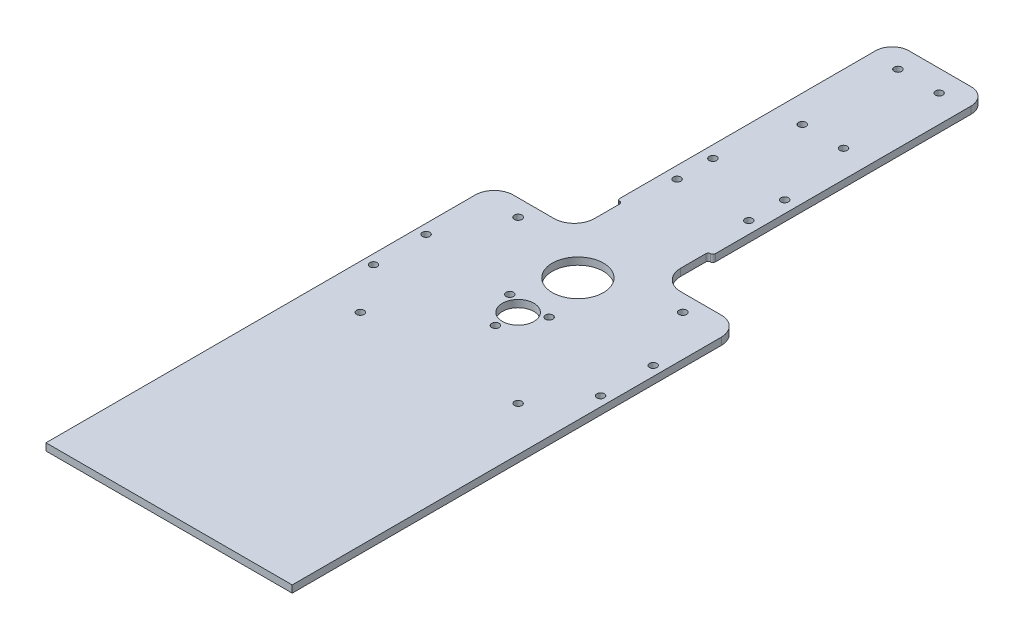
from build123d import *

# Parameters (mm, degrees)
SKETCH_1_W              = 200
SKETCH_1_H              = 200
EXTRUDE_1_DEPTH         = 3
SKETCH_2_R              = 1.5
CUT_EXTRUDE_2_DEPTH     = 10
CUT_EXTRUDE_3_DEPTH     = 10
SKETCH_6_R              = 1.55
CUT_EXTRUDE_3_1_1_DEPTH = 10
CUT_EXTRUDE_6_REACH     = 111.495
SKETCH_11_R             = 1.5
CUT_EXTRUDE_21_4_REACH  = 111.495
SKETCH_4_R              = 10.7
FILLET_1_R              = 1
SKETCH_12_W             = 40
SKETCH_12_H             = 3
EXTRUDE_2_DEPTH         = 75
FILLET_2_R              = 7
SKETCH_13_R             = 1.55
CUT_EXTRUDE_3_1_3_DEPTH = 10
CUT_EXTRUDE_2006_REACH  = 132.367
SKETCH_14_R             = 1.55
SKETCH_14_R_2           = 6.6
SKETCH_18_R             = 1.55
CUT_EXTRUDE_2_2_DEPTH   = 8
SKETCH_19_W             = 89
SKETCH_19_H             = 3
EXTRUDE_3_DEPTH         = 100
SKETCH_20_W             = 187.5
SKETCH_20_H             = 3
EXTRUDE_4_DEPTH         = 7
FILLET_3_R              = 8
CUT_EXTRUDE_9693_REACH  = 208.546
SKETCH_17_R             = 1.55
CUT_EXTRUDE_10600_REACH = 208.546
SKETCH_16_R             = 1.6


with BuildPart() as part:
    # 草图1 → 凸台-拉伸1 (new body)
    with BuildSketch(Plane(origin=(0, 0, 0), x_dir=(1, 0, 0), z_dir=(0, 1, 0))):
        Rectangle(SKETCH_1_W, SKETCH_1_H)
    extrude(amount=EXTRUDE_1_DEPTH)

    # 草图2 → Cut-Extrude 2 (cut)
    with BuildSketch(Plane(origin=(0, 3, 0), x_dir=(1, 0, 0), z_dir=(0, 1, 0))):
        with Locations(Location((29.5, 9.5, 0), (0, 0, 270))):
            Circle(SKETCH_2_R)
        with Locations(Location((21.5, 0, 0), (0, 0, 270))):
            Circle(SKETCH_2_R)
        with Locations(Location((29.5, -9.5, 0), (0, 0, 270))):
            Circle(SKETCH_2_R)
        with Locations(Location((37.5, 0, 0), (0, 0, 270))):
            Circle(SKETCH_2_R)
        with Locations(Location((-29.5, -9.5, 0), (0, 0, 270))):
            Circle(SKETCH_2_R)
        with Locations(Location((-37.5, 0, 0), (0, 0, 270))):
            Circle(SKETCH_2_R)
        with Locations(Location((-21.5, 0, 0), (0, 0, 270))):
            Circle(SKETCH_2_R)
        with Locations(Location((-29.5, 9.5, 0), (0, 0, 270))):
            Circle(SKETCH_2_R)
    extrude(amount=-CUT_EXTRUDE_2_DEPTH, mode=Mode.SUBTRACT)

    # 草图5 → 切除-拉伸3 (cut)
    with BuildSketch(Plane(origin=(0, 3, 0), x_dir=(1, 0, 0), z_dir=(0, 1, 0))):
        with BuildLine():
            Line((-100, -100), (-44.5, -100))
            Line((-44.5, -100), (-44.5, 0))
            ThreePointArc((-44.5, 0), (-40.212142643, 10.5), (-29.8, 14.9969997))
            ThreePointArc((-29.8, 14.9969997), (-22.858571571, 17.9949995), (-20, 24.9949995))
            Line((-20, 24.9949995), (-20, 47.5))
            Line((-20, 47.5), (0, 47.5))
            Line((0, 47.5), (20, 47.5))
            Line((20, 47.5), (20, 24.9949995))
            ThreePointArc((20, 24.9949995), (22.858571571, 17.9949995), (29.8, 14.9969997))
            ThreePointArc((29.8, 14.9969997), (40.212142643, 10.5), (44.5, 0))
            Line((44.5, 0), (44.5, -100))
            Line((44.5, -100), (100, -100))
            Line((100, -100), (100, 100))
            Line((100, 100), (-100, 100))
            Line((-100, 100), (-100, -100))
        make_face()
    extrude(amount=-CUT_EXTRUDE_3_DEPTH, mode=Mode.SUBTRACT)

    # 草图6 → φ3.1通孔1 (cut)
    with BuildSketch(Plane.XZ):
        with Locations(Location((-15, -42.5, 0), (0, 0, 270))):
            Circle(SKETCH_6_R)
        with Locations(Location((-15, -27.5, 0), (0, 0, 270))):
            Circle(SKETCH_6_R)
        with Locations(Location((15, -27.5, 0), (0, 0, 90))):
            Circle(SKETCH_6_R)
        with Locations(Location((15, -42.5, 0), (0, 0, 90))):
            Circle(SKETCH_6_R)
    extrude(amount=-CUT_EXTRUDE_3_1_1_DEPTH, mode=Mode.SUBTRACT)

    # 草图11 → 切除-拉伸6 (cut, up to next)
    with BuildSketch(Plane(origin=(0, 3, 0), x_dir=(1, 0, 0), z_dir=(0, 1, 0)), mode=Mode.PRIVATE) as cut_extrude_6_sk1:
        with BuildLine():
            Line((44.5, -17.5), (44.5, -100))
            Line((44.5, -100), (101.133062566, -100))
            Line((101.133062566, -100), (101.133062566, 47.5))
            Line((101.133062566, 47.5), (20, 47.5))
            Line((20, 47.5), (20, 7.5))
            Line((20, 7.5), (19, 7.5))
            ThreePointArc((19, 7.5), (18.292893219, 7.207106781), (18, 6.5))
            Line((18, 6.5), (18, -4))
            ThreePointArc((18, -4), (20.48959236, -10.01040764), (26.5, -12.5))
            Line((26.5, -12.5), (39.5, -12.5))
            Line((39.5, -12.5), (44.5, -12.5))
            Line((44.5, -12.5), (44.5, -17.5))
        make_face()
        with Locations((29.5, -9.5)):
            Circle(SKETCH_11_R, mode=Mode.SUBTRACT)
        with Locations((21.5, 0)):
            Circle(SKETCH_11_R, mode=Mode.SUBTRACT)
    cut_extrude_6_tool1 = extrude(cut_extrude_6_sk1.sketch, amount=-CUT_EXTRUDE_6_REACH, mode=Mode.PRIVATE) & part.part
    # 草图11 → 切除-拉伸6 (cut, up to next)
    with BuildSketch(Plane(origin=(0, 3, 0), x_dir=(1, 0, 0), z_dir=(0, 1, 0)), mode=Mode.PRIVATE) as cut_extrude_6_sk2:
        with BuildLine():
            Line((-44.5, -17.5), (-44.5, -100))
            Line((-44.5, -100), (-101.133062566, -100))
            Line((-101.133062566, -100), (-101.133062566, 47.5))
            Line((-101.133062566, 47.5), (-20, 47.5))
            Line((-20, 47.5), (-20, 7.5))
            Line((-20, 7.5), (-19, 7.5))
            ThreePointArc((-19, 7.5), (-18.292893219, 7.207106781), (-18, 6.5))
            Line((-18, 6.5), (-18, -4))
            ThreePointArc((-18, -4), (-20.48959236, -10.01040764), (-26.5, -12.5))
            Line((-26.5, -12.5), (-39.5, -12.5))
            Line((-39.5, -12.5), (-44.5, -12.5))
            Line((-44.5, -12.5), (-44.5, -17.5))
        make_face()
    cut_extrude_6_tool2 = extrude(cut_extrude_6_sk2.sketch, amount=-CUT_EXTRUDE_6_REACH, mode=Mode.PRIVATE) & part.part
    add(cut_extrude_6_tool1.solids().sort_by_distance((66.686037, 3, 19.669577))[0], mode=Mode.SUBTRACT)
    add(cut_extrude_6_tool2.solids().sort_by_distance((-66.626911, 3, 19.648158))[0], mode=Mode.SUBTRACT)

    # 草图4 → φ21.4落弹孔 (cut, up to next)
    with BuildSketch(Plane(origin=(0, 3, 0), x_dir=(1, 0, 0), z_dir=(0, 1, 0)), mode=Mode.PRIVATE) as cut_extrude_21_4_sk1:
        with Locations(Location((0, -29, 0), (0, 0, 270))):
            Circle(SKETCH_4_R)
    cut_extrude_21_4_tool1 = extrude(cut_extrude_21_4_sk1.sketch, amount=-CUT_EXTRUDE_21_4_REACH, mode=Mode.PRIVATE) & part.part
    add(cut_extrude_21_4_tool1.solids().sort_by_distance((0, 3, 29))[0], mode=Mode.SUBTRACT)

    # 圆角1
    fillet_1_edges = [part.edges().sort_by_distance(p)[0] for p in [
        (-20, 1.5, -7.5),
        (20, 1.5, -7.5),
    ]]
    fillet(fillet_1_edges, radius=FILLET_1_R - 0.0001)  # a hair under: the kernel refuses the full size

    # 草图12 → 凸台-拉伸2 (add)
    with BuildSketch(Plane(origin=(0, 0, -47.5), x_dir=(-1, 0, 0), z_dir=(0, 0, -1))):
        with Locations((0, 1.5)):
            Rectangle(SKETCH_12_W, SKETCH_12_H)
    extrude(amount=EXTRUDE_2_DEPTH)

    # 圆角2
    fillet_2_edges = [part.edges().sort_by_distance(p)[0] for p in [
        (20, 1.5, -122.5),
        (-20, 1.5, -122.5),
    ]]
    fillet(fillet_2_edges, radius=FILLET_2_R)

    # 草图13 → φ3.1通孔3 (cut)
    with BuildSketch(Plane(origin=(0, 3, 0), x_dir=(1, 0, 0), z_dir=(0, 1, 0))):
        with Locations(Location((-8.625, 113.5, 0), (0, 0, 270))):
            Circle(SKETCH_13_R)
        with Locations(Location((8.625, 113.5, 0), (0, 0, 270))):
            Circle(SKETCH_13_R)
        with Locations(Location((8.625, 73.5, 0), (0, 0, 270))):
            Circle(SKETCH_13_R)
        with Locations(Location((-8.625, 73.5, 0), (0, 0, 270))):
            Circle(SKETCH_13_R)
    extrude(amount=-CUT_EXTRUDE_3_1_3_DEPTH, mode=Mode.SUBTRACT)

    # 草图14 → 2006电机固定 (cut, up to next)
    with BuildSketch(Plane(origin=(0, 3, 0), x_dir=(1, 0, 0), z_dir=(0, 1, 0)), mode=Mode.PRIVATE) as cut_extrude_2006_sk1:
        with Locations(Location((0, -63.5, 0), (0, 0, 270))):
            Circle(SKETCH_14_R)
    cut_extrude_2006_tool1 = extrude(cut_extrude_2006_sk1.sketch, amount=-CUT_EXTRUDE_2006_REACH, mode=Mode.PRIVATE) & part.part
    # 草图14 → 2006电机固定 (cut, up to next)
    with BuildSketch(Plane(origin=(0, 3, 0), x_dir=(1, 0, 0), z_dir=(0, 1, 0)), mode=Mode.PRIVATE) as cut_extrude_2006_sk2:
        with Locations(Location((-8.227241336, -49.25, 0), (0, 0, 270))):
            Circle(SKETCH_14_R)
    cut_extrude_2006_tool2 = extrude(cut_extrude_2006_sk2.sketch, amount=-CUT_EXTRUDE_2006_REACH, mode=Mode.PRIVATE) & part.part
    # 草图14 → 2006电机固定 (cut, up to next)
    with BuildSketch(Plane(origin=(0, 3, 0), x_dir=(1, 0, 0), z_dir=(0, 1, 0)), mode=Mode.PRIVATE) as cut_extrude_2006_sk3:
        with Locations(Location((8.227241336, -49.25, 0), (0, 0, 270))):
            Circle(SKETCH_14_R)
    cut_extrude_2006_tool3 = extrude(cut_extrude_2006_sk3.sketch, amount=-CUT_EXTRUDE_2006_REACH, mode=Mode.PRIVATE) & part.part
    # 草图14 → 2006电机固定 (cut, up to next)
    with BuildSketch(Plane(origin=(0, 3, 0), x_dir=(1, 0, 0), z_dir=(0, 1, 0)), mode=Mode.PRIVATE) as cut_extrude_2006_sk4:
        with Locations(Location((0, -54, 0), (0, 0, 270))):
            Circle(SKETCH_14_R_2)
    cut_extrude_2006_tool4 = extrude(cut_extrude_2006_sk4.sketch, amount=-CUT_EXTRUDE_2006_REACH, mode=Mode.PRIVATE) & part.part
    add(cut_extrude_2006_tool1.solids().sort_by_distance((0, 3, 63.5))[0], mode=Mode.SUBTRACT)
    add(cut_extrude_2006_tool2.solids().sort_by_distance((-8.227241, 3, 49.25))[0], mode=Mode.SUBTRACT)
    add(cut_extrude_2006_tool3.solids().sort_by_distance((8.227241, 3, 49.25))[0], mode=Mode.SUBTRACT)
    add(cut_extrude_2006_tool4.solids().sort_by_distance((0, 3, 54))[0], mode=Mode.SUBTRACT)

    # 草图18 → Cut-Extrude 2 2 (cut)
    with BuildSketch(Plane(origin=(0, 3, 0), x_dir=(1, 0, 0), z_dir=(0, 1, 0))):
        with Locations(Location((33, -87, 0), (0, 0, 270))):
            Circle(SKETCH_18_R)
        with Locations(Location((-33, -87, 0), (0, 0, 270))):
            Circle(SKETCH_18_R)
    extrude(amount=-CUT_EXTRUDE_2_2_DEPTH, mode=Mode.SUBTRACT)

    # 草图19 → 凸台-拉伸3 (add)
    with BuildSketch(Plane.XY.offset(100)):
        with Locations((0, 1.5)):
            Rectangle(SKETCH_19_W, SKETCH_19_H)
    extrude(amount=EXTRUDE_3_DEPTH)

    # 草图20 → 凸台-拉伸4 (add)
    with BuildSketch(Plane.ZY.offset(44.5)):
        with Locations((106.25, 1.5)):
            Rectangle(SKETCH_20_W, SKETCH_20_H)
    extrude_4 = extrude(amount=EXTRUDE_4_DEPTH)

    # 镜向2: 凸台-拉伸4 across plane
    add(extrude_4.mirror(Plane(origin=(0, 0, 0), x_dir=(0, 0, 1), z_dir=(1, 0, 0))))

    # 圆角3
    fillet_3_edges = [part.edges().sort_by_distance(p)[0] for p in [
        (-51.5, 1.5, 12.5),
        (51.5, 1.5, 12.5),
    ]]
    fillet(fillet_3_edges, radius=FILLET_3_R)

    # 草图17 → Cut-Extrude 9693 (cut, up to next)
    with BuildSketch(Plane(origin=(0, 3, 0), x_dir=(1, 0, 0), z_dir=(0, 1, 0)), mode=Mode.PRIVATE) as cut_extrude_9693_sk1:
        with Locations(Location((-47.5, -45, 0), (0, 0, 270))):
            Circle(SKETCH_17_R)
    cut_extrude_9693_tool1 = extrude(cut_extrude_9693_sk1.sketch, amount=-CUT_EXTRUDE_9693_REACH, mode=Mode.PRIVATE) & part.part
    # 草图17 → Cut-Extrude 9693 (cut, up to next)
    with BuildSketch(Plane(origin=(0, 3, 0), x_dir=(1, 0, 0), z_dir=(0, 1, 0)), mode=Mode.PRIVATE) as cut_extrude_9693_sk2:
        with Locations(Location((-47.5, -67, 0), (0, 0, 270))):
            Circle(SKETCH_17_R)
    cut_extrude_9693_tool2 = extrude(cut_extrude_9693_sk2.sketch, amount=-CUT_EXTRUDE_9693_REACH, mode=Mode.PRIVATE) & part.part
    # 草图17 → Cut-Extrude 9693 (cut, up to next)
    with BuildSketch(Plane(origin=(0, 3, 0), x_dir=(1, 0, 0), z_dir=(0, 1, 0)), mode=Mode.PRIVATE) as cut_extrude_9693_sk3:
        with Locations(Location((47.5, -67, 0), (0, 0, 270))):
            Circle(SKETCH_17_R)
    cut_extrude_9693_tool3 = extrude(cut_extrude_9693_sk3.sketch, amount=-CUT_EXTRUDE_9693_REACH, mode=Mode.PRIVATE) & part.part
    # 草图17 → Cut-Extrude 9693 (cut, up to next)
    with BuildSketch(Plane(origin=(0, 3, 0), x_dir=(1, 0, 0), z_dir=(0, 1, 0)), mode=Mode.PRIVATE) as cut_extrude_9693_sk4:
        with Locations(Location((47.5, -45, 0), (0, 0, 270))):
            Circle(SKETCH_17_R)
    cut_extrude_9693_tool4 = extrude(cut_extrude_9693_sk4.sketch, amount=-CUT_EXTRUDE_9693_REACH, mode=Mode.PRIVATE) & part.part
    add(cut_extrude_9693_tool1.solids().sort_by_distance((-47.5, 3, 45))[0], mode=Mode.SUBTRACT)
    add(cut_extrude_9693_tool2.solids().sort_by_distance((-47.5, 3, 67))[0], mode=Mode.SUBTRACT)
    add(cut_extrude_9693_tool3.solids().sort_by_distance((47.5, 3, 67))[0], mode=Mode.SUBTRACT)
    add(cut_extrude_9693_tool4.solids().sort_by_distance((47.5, 3, 45))[0], mode=Mode.SUBTRACT)

    # 草图16 → Cut-Extrude 10600 (cut, up to next)
    with BuildSketch(Plane(origin=(0, 3, 0), x_dir=(1, 0, 0), z_dir=(0, 1, 0)), mode=Mode.PRIVATE) as cut_extrude_10600_sk1:
        with Locations(Location((-34.446696938, -19.553303062, 0), (0, 0, 270))):
            Circle(SKETCH_16_R)
    cut_extrude_10600_tool1 = extrude(cut_extrude_10600_sk1.sketch, amount=-CUT_EXTRUDE_10600_REACH, mode=Mode.PRIVATE) & part.part
    # 草图16 → Cut-Extrude 10600 (cut, up to next)
    with BuildSketch(Plane(origin=(0, 3, 0), x_dir=(1, 0, 0), z_dir=(0, 1, 0)), mode=Mode.PRIVATE) as cut_extrude_10600_sk2:
        with Locations(Location((34.446696938, -19.553303062, 0), (0, 0, 270))):
            Circle(SKETCH_16_R)
    cut_extrude_10600_tool2 = extrude(cut_extrude_10600_sk2.sketch, amount=-CUT_EXTRUDE_10600_REACH, mode=Mode.PRIVATE) & part.part
    add(cut_extrude_10600_tool1.solids().sort_by_distance((-34.446697, 3, 19.553303))[0], mode=Mode.SUBTRACT)
    add(cut_extrude_10600_tool2.solids().sort_by_distance((34.446697, 3, 19.553303))[0], mode=Mode.SUBTRACT)


solid = part.part
